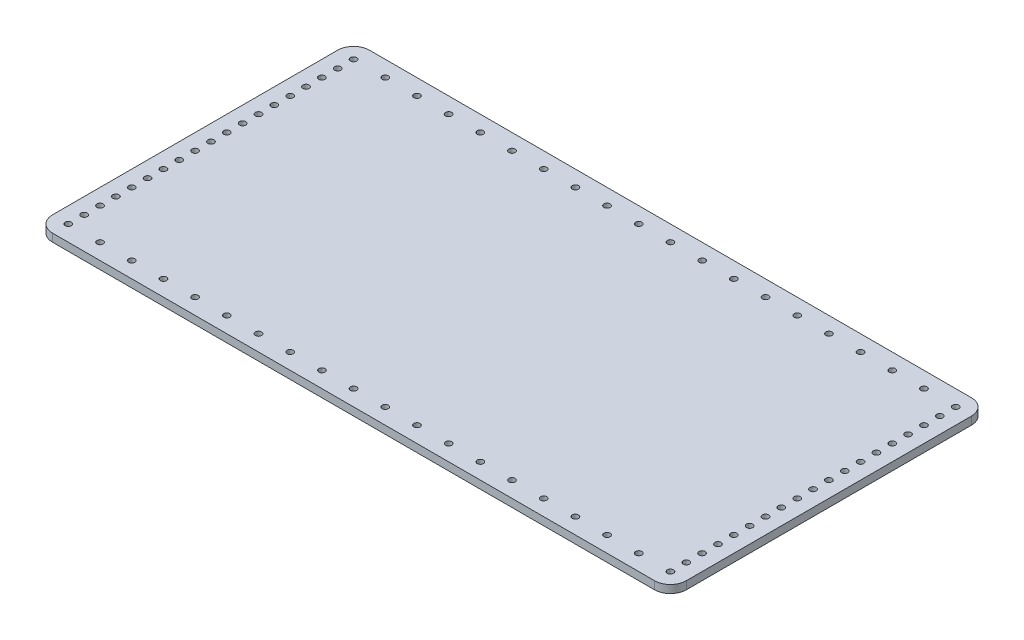
from build123d import *

# Parameters (mm, degrees)
SKETCH1_W           = 508
SKETCH1_H           = 254
BOSS_EXTRUDE1_DEPTH = 6.35
FILLET1_R           = 12.7
SKETCH3_R           = 2.4892
CUT_EXTRUDE2_DEPTH  = 568.996762755


with BuildPart() as part:
    # Sketch1 → Boss-Extrude1 (new body)
    with BuildSketch(Plane(origin=(0, 0, 0), x_dir=(1, 0, 0), z_dir=(0, 1, 0))):
        with Locations((254, 127)):
            Rectangle(SKETCH1_W, SKETCH1_H)
    extrude(amount=BOSS_EXTRUDE1_DEPTH)

    # Fillet1
    fillet1_edges = [part.edges().sort_by_distance(p)[0] for p in [
        (508, 3.175, -254),
        (508, 3.175, 0),
        (0, 3.175, 0),
        (0, 3.175, -254),
    ]]
    fillet(fillet1_edges, radius=FILLET1_R)

    # Sketch3 → Cut-Extrude2 (cut, through all)
    with BuildSketch(Plane(origin=(0, 6.35, 0), x_dir=(1, 0, 0), z_dir=(0, 1, 0))):
        with Locations((12.7, 241.3)):
            Circle(SKETCH3_R)
        with Locations((38.1, 241.3)):
            Circle(SKETCH3_R)
        with Locations((63.5, 241.3)):
            Circle(SKETCH3_R)
        with Locations((88.9, 241.3)):
            Circle(SKETCH3_R)
        with Locations((114.3, 241.3)):
            Circle(SKETCH3_R)
        with Locations((139.7, 241.3)):
            Circle(SKETCH3_R)
        with Locations((165.1, 241.3)):
            Circle(SKETCH3_R)
        with Locations((190.5, 241.3)):
            Circle(SKETCH3_R)
        with Locations((215.9, 241.3)):
            Circle(SKETCH3_R)
        with Locations((241.3, 241.3)):
            Circle(SKETCH3_R)
        with Locations((266.7, 241.3)):
            Circle(SKETCH3_R)
        with Locations((292.1, 241.3)):
            Circle(SKETCH3_R)
        with Locations((317.5, 241.3)):
            Circle(SKETCH3_R)
        with Locations((342.9, 241.3)):
            Circle(SKETCH3_R)
        with Locations((368.3, 241.3)):
            Circle(SKETCH3_R)
        with Locations((393.7, 241.3)):
            Circle(SKETCH3_R)
        with Locations((419.1, 241.3)):
            Circle(SKETCH3_R)
        with Locations((444.5, 241.3)):
            Circle(SKETCH3_R)
        with Locations((469.9, 241.3)):
            Circle(SKETCH3_R)
        with Locations((495.3, 241.3)):
            Circle(SKETCH3_R)
        with Locations((12.7, 228.6)):
            Circle(SKETCH3_R)
        with Locations((12.7, 215.9)):
            Circle(SKETCH3_R)
        with Locations((12.7, 203.2)):
            Circle(SKETCH3_R)
        with Locations((12.7, 190.5)):
            Circle(SKETCH3_R)
        with Locations((12.7, 177.8)):
            Circle(SKETCH3_R)
        with Locations((12.7, 165.1)):
            Circle(SKETCH3_R)
        with Locations((12.7, 152.4)):
            Circle(SKETCH3_R)
        with Locations((12.7, 139.7)):
            Circle(SKETCH3_R)
        with Locations((12.7, 127)):
            Circle(SKETCH3_R)
        with Locations((12.7, 114.3)):
            Circle(SKETCH3_R)
        with Locations((12.7, 101.6)):
            Circle(SKETCH3_R)
        with Locations((12.7, 88.9)):
            Circle(SKETCH3_R)
        with Locations((12.7, 63.5)):
            Circle(SKETCH3_R)
        with Locations((12.7, 38.1)):
            Circle(SKETCH3_R)
        with Locations((12.7, 12.7)):
            Circle(SKETCH3_R)
        with Locations((12.7, 76.2)):
            Circle(SKETCH3_R)
        with Locations((12.7, 50.8)):
            Circle(SKETCH3_R)
        with Locations((12.7, 25.4)):
            Circle(SKETCH3_R)
        with Locations((38.1, 12.7)):
            Circle(SKETCH3_R)
        with Locations((63.5, 12.7)):
            Circle(SKETCH3_R)
        with Locations((88.9, 12.7)):
            Circle(SKETCH3_R)
        with Locations((114.3, 12.7)):
            Circle(SKETCH3_R)
        with Locations((139.7, 12.7)):
            Circle(SKETCH3_R)
        with Locations((165.1, 12.7)):
            Circle(SKETCH3_R)
        with Locations((190.5, 12.7)):
            Circle(SKETCH3_R)
        with Locations((215.9, 12.7)):
            Circle(SKETCH3_R)
        with Locations((241.3, 12.7)):
            Circle(SKETCH3_R)
        with Locations((266.7, 12.7)):
            Circle(SKETCH3_R)
        with Locations((292.1, 12.7)):
            Circle(SKETCH3_R)
        with Locations((317.5, 12.7)):
            Circle(SKETCH3_R)
        with Locations((342.9, 12.7)):
            Circle(SKETCH3_R)
        with Locations((368.3, 12.7)):
            Circle(SKETCH3_R)
        with Locations((393.7, 12.7)):
            Circle(SKETCH3_R)
        with Locations((419.1, 12.7)):
            Circle(SKETCH3_R)
        with Locations((444.5, 12.7)):
            Circle(SKETCH3_R)
        with Locations((469.9, 12.7)):
            Circle(SKETCH3_R)
        with Locations((495.3, 12.7)):
            Circle(SKETCH3_R)
        with Locations((495.3, 228.6)):
            Circle(SKETCH3_R)
        with Locations((495.3, 215.9)):
            Circle(SKETCH3_R)
        with Locations((495.3, 203.2)):
            Circle(SKETCH3_R)
        with Locations((495.3, 190.5)):
            Circle(SKETCH3_R)
        with Locations((495.3, 177.8)):
            Circle(SKETCH3_R)
        with Locations((495.3, 165.1)):
            Circle(SKETCH3_R)
        with Locations((495.3, 152.4)):
            Circle(SKETCH3_R)
        with Locations((495.3, 139.7)):
            Circle(SKETCH3_R)
        with Locations((495.3, 127)):
            Circle(SKETCH3_R)
        with Locations((495.3, 114.3)):
            Circle(SKETCH3_R)
        with Locations((495.3, 101.6)):
            Circle(SKETCH3_R)
        with Locations((495.3, 88.9)):
            Circle(SKETCH3_R)
        with Locations((495.3, 76.2)):
            Circle(SKETCH3_R)
        with Locations((495.3, 63.5)):
            Circle(SKETCH3_R)
        with Locations((495.3, 50.8)):
            Circle(SKETCH3_R)
        with Locations((495.3, 38.1)):
            Circle(SKETCH3_R)
        with Locations((495.3, 25.4)):
            Circle(SKETCH3_R)
    extrude(amount=-CUT_EXTRUDE2_DEPTH, mode=Mode.SUBTRACT)


solid = part.part
